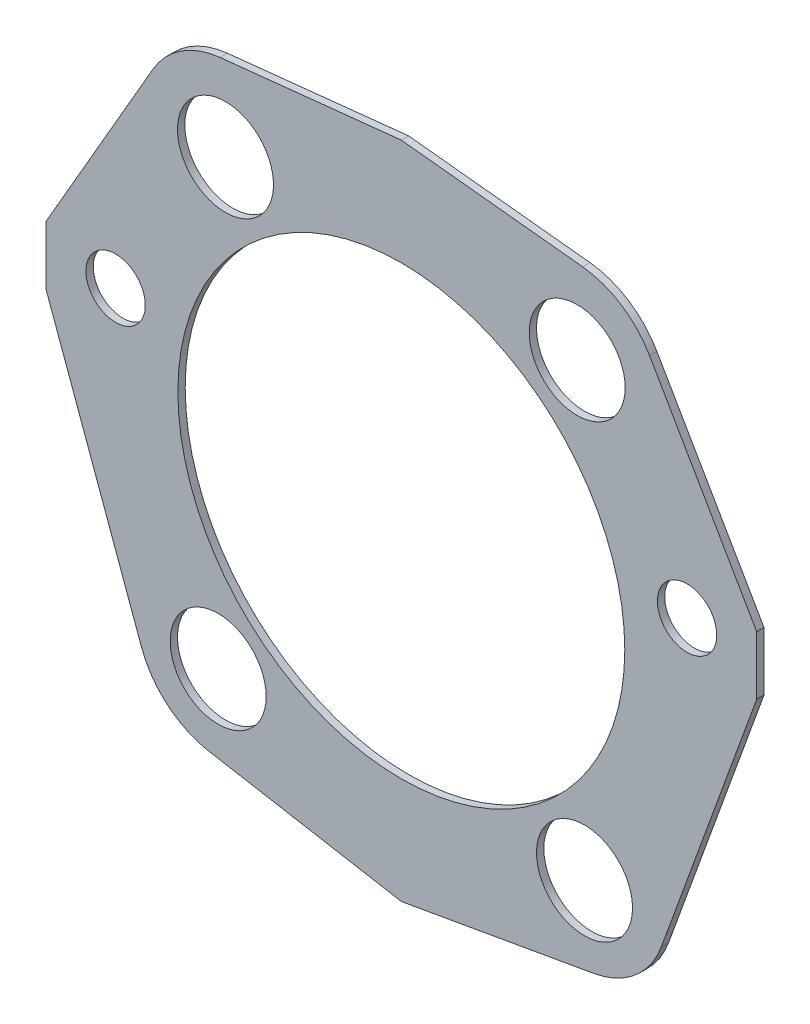
from build123d import *

# Parameters (mm, degrees)
SKETCH1_R           = 30.5
SKETCH1_R_2         = 6.55
SKETCH1_R_3         = 4.05
BOSS_EXTRUDE1_DEPTH = 1


with BuildPart() as part:
    # Sketch1 → Boss-Extrude1 (new body)
    with BuildSketch(Plane.XY):
        with BuildLine():
            Line((0, 45), (24.742465391, 42.399462096))
            ThreePointArc((24.742465391, 42.399462096), (30.023792252, 40.529246167), (33.880428677, 36.465199352))
            Line((33.880428677, 36.465199352), (48.5, 11.143359036))
            Line((48.5, 11.143359036), (48.5, 3.143359036))
            Line((48.5, 3.143359036), (35.471224905, -32.652906339))
            ThreePointArc((35.471224905, -32.652906339), (31.908364772, -37.741197937), (26.278691588, -40.366357655))
            Line((26.278691588, -40.366357655), (0, -45))
            Line((0, -45), (-26.278691588, -40.366357655))
            ThreePointArc((-26.278691588, -40.366357655), (-31.908364772, -37.741197937), (-35.471224905, -32.652906339))
            Line((-35.471224905, -32.652906339), (-48.5, 3.143359036))
            Line((-48.5, 3.143359036), (-48.5, 11.143359036))
            Line((-48.5, 11.143359036), (-33.880428677, 36.465199352))
            ThreePointArc((-33.880428677, 36.465199352), (-30.023792252, 40.529246167), (-24.742465391, 42.399462096))
            Line((-24.742465391, 42.399462096), (0, 45))
        make_face()
        Circle(SKETCH1_R, mode=Mode.SUBTRACT)
        with Locations((24, 31)):
            Circle(SKETCH1_R_2, mode=Mode.SUBTRACT)
        with Locations((-24, 31)):
            Circle(SKETCH1_R_2, mode=Mode.SUBTRACT)
        with Locations((-25, -30)):
            Circle(SKETCH1_R_2, mode=Mode.SUBTRACT)
        with Locations((25, -30)):
            Circle(SKETCH1_R_2, mode=Mode.SUBTRACT)
        with Locations((39, 8)):
            Circle(SKETCH1_R_3, mode=Mode.SUBTRACT)
        with Locations((-39, 8)):
            Circle(SKETCH1_R_3, mode=Mode.SUBTRACT)
    extrude(amount=-BOSS_EXTRUDE1_DEPTH)


solid = part.part
